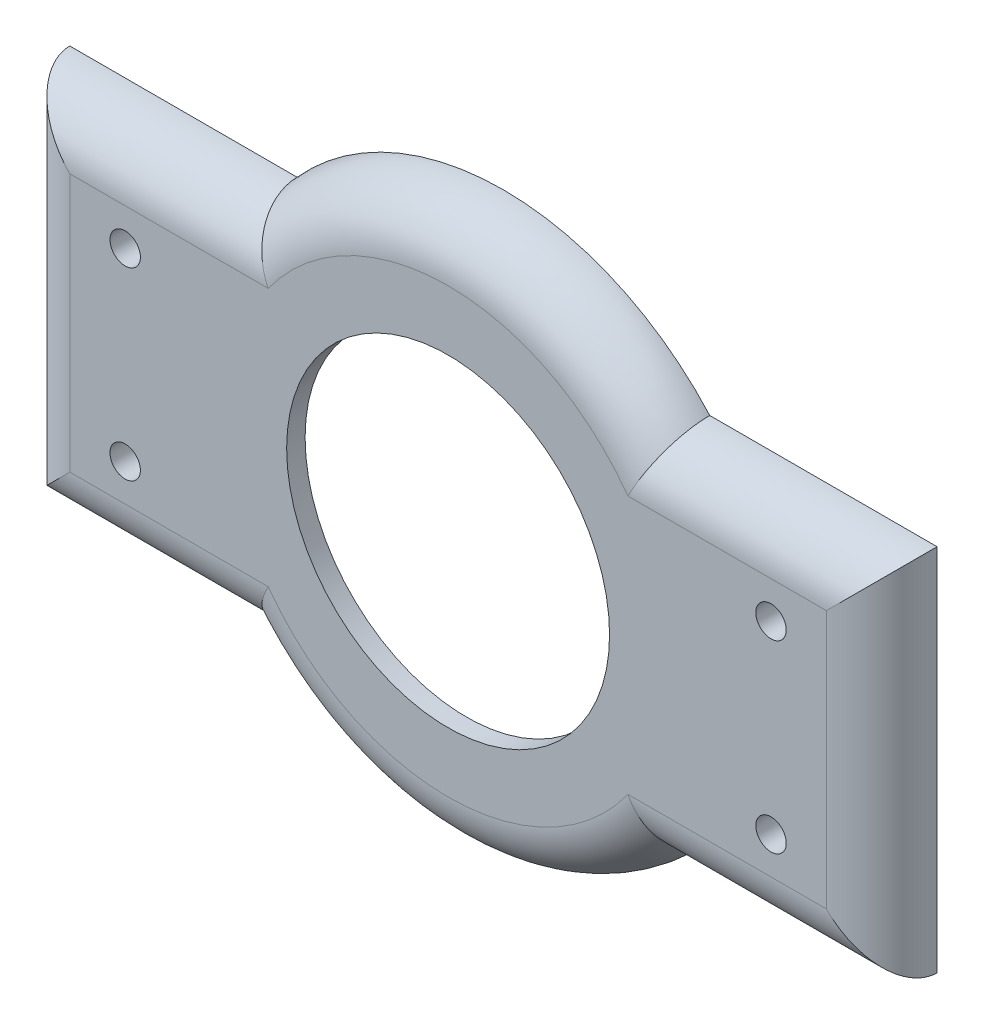
from build123d import *

# Parameters (mm, degrees)
SKETCH1_R             = 30
BOSS_EXTRUDE1_DEPTH   = 2
BOSS_EXTRUDE2_START   = 4
SKETCH2_R             = 30
SKETCH2_R_2           = 25
BOSS_EXTRUDE2_DEPTH   = 4
BOSS_EXTRUDE3_REACH   = 44.849
SKETCH3_W             = 94
SKETCH3_H             = 40
SKETCH4_R             = 25
CUT_EXTRUDE1_DEPTH    = 4
SKETCH5_R             = 17.5
CUT_EXTRUDE2_DEPTH    = 56.901699437
FILLET1_R             = 6
M4X0_7_TAPPED_HOLE1_D = 3.3


with BuildPart() as part:
    # Sketch1 → Boss-Extrude1 (new body)
    with BuildSketch(Plane.XY):
        Circle(SKETCH1_R)
    extrude(amount=BOSS_EXTRUDE1_DEPTH)

    # Sketch2 → Boss-Extrude2 (add)
    with BuildSketch(Plane(origin=(0, 0, 0), x_dir=(-1, 0, 0), z_dir=(0, 0, -1)).offset(BOSS_EXTRUDE2_START)):
        Circle(SKETCH2_R)
        Circle(SKETCH2_R_2, mode=Mode.SUBTRACT)
    extrude(amount=-BOSS_EXTRUDE2_DEPTH)

    # Boss-Extrude3: up to this face of the body (flat: up to its plane)
    boss_extrude3_end = Plane(part.part.faces().sort_by_distance((0, 0, 2))[0])
    # Sketch3 → Boss-Extrude3 (add, up to the picked face)
    with BuildSketch(Plane(origin=(0, 0, -4), x_dir=(-1, 0, 0), z_dir=(0, 0, -1)), mode=Mode.PRIVATE) as boss_extrude3_sk1:
        Rectangle(SKETCH3_W, SKETCH3_H)
    boss_extrude3_tool1 = split(extrude(boss_extrude3_sk1.sketch, amount=-BOSS_EXTRUDE3_REACH, mode=Mode.PRIVATE), bisect_by=boss_extrude3_end, keep=Keep.BOTH, mode=Mode.PRIVATE)
    add(boss_extrude3_tool1.solids().sort_by(Axis((0, 0, -4), (0, 0, 1)))[0])

    # Sketch4 → Cut-Extrude1 (cut)
    with BuildSketch(Plane(origin=(0, 0, -4), x_dir=(-1, 0, 0), z_dir=(0, 0, -1))):
        Circle(SKETCH4_R)
    extrude(amount=-CUT_EXTRUDE1_DEPTH, mode=Mode.SUBTRACT)

    # Sketch5 → Cut-Extrude2 (cut, through all)
    with BuildSketch(Plane(origin=(0, 0, 0), x_dir=(-1, 0, 0), z_dir=(0, 0, -1))):
        Circle(SKETCH5_R)
    extrude(amount=-CUT_EXTRUDE2_DEPTH, mode=Mode.SUBTRACT)

    # Fillet1
    fillet1_edges = [part.edges().sort_by_distance(p)[0] for p in [
        (47, 0, 2),
        (34.680339887, -20, 2),
        (34.680339887, 20, 2),
        (0, 30, 2),
        (0, -30, 2),
        (-34.680339887, -20, 2),
        (-47, 0, 2),
        (-34.680339887, 20, 2),
    ]]
    fillet(fillet1_edges, radius=FILLET1_R - 0.0001)  # a hair under: the kernel refuses the full size

    # M4x0.7 Tapped Hole1 (through all)
    with Locations(Plane.XY.offset(2)):
        with Locations((-35, 10), (-35, -10), (35, 10), (35, -10)):
            Hole(M4X0_7_TAPPED_HOLE1_D / 2)


solid = part.part
